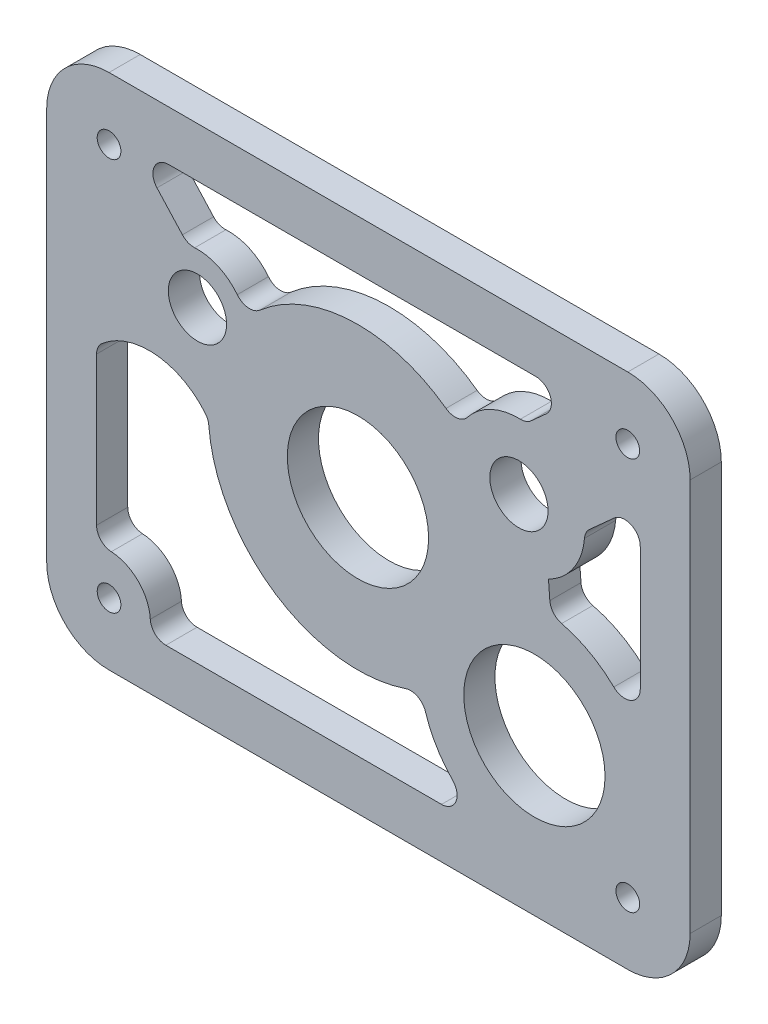
from build123d import *

# Parameters (mm, degrees)
SKETCH1_R           = 14.3891
SKETCH1_R_2         = 5.9309
BOSS_EXTRUDE2_DEPTH = 6.35
SKETCH2_R           = 2.413
CUT_EXTRUDE1_DEPTH  = 6.35
CUT_EXTRUDE6_DEPTH  = 25.4
FILLET4_R           = 3.175
FILLET6_R           = 3.175
FILLET5_R           = 3.175


with BuildPart() as part:
    # Sketch1 → Boss-Extrude2 (new body)
    with BuildSketch(Plane.XY):
        with BuildLine():
            Line((54.963119593, 49.587781591), (-50.700880407, 49.587781591))
            ThreePointArc((-50.700880407, 49.587781591), (-59.681136528, 45.868037712), (-63.400880407, 36.887781591))
            Line((-63.400880407, 36.887781591), (-63.400880407, -43.122218409))
            ThreePointArc((-63.400880407, -43.122218409), (-59.681136528, -52.10247453), (-50.700880407, -55.822218409))
            Line((-50.700880407, -55.822218409), (54.963119593, -55.822218409))
            ThreePointArc((54.963119593, -55.822218409), (63.943375714, -52.10247453), (67.663119593, -43.122218409))
            Line((67.663119593, -43.122218409), (67.663119593, 36.887781591))
            ThreePointArc((67.663119593, 36.887781591), (63.943375714, 45.868037712), (54.963119593, 49.587781591))
        make_face()
        with Locations((35.939214506, -24.072218409)):
            Circle(SKETCH1_R, mode=Mode.SUBTRACT)
        with Locations((-32.69260882, 17.124862832)):
            Circle(SKETCH1_R_2, mode=Mode.SUBTRACT)
        Circle(SKETCH1_R, mode=Mode.SUBTRACT)
        with Locations((32.791546632, 16.934641063)):
            Circle(SKETCH1_R_2, mode=Mode.SUBTRACT)
    extrude(amount=BOSS_EXTRUDE2_DEPTH)

    # Sketch2 → Cut-Extrude1 (cut)
    with BuildSketch(Plane.XY.offset(6.35)):
        with Locations((-50.700880407, 36.887781591)):
            Circle(SKETCH2_R)
        with Locations((54.963119593, 36.887781591)):
            Circle(SKETCH2_R)
        with Locations((54.963119593, -43.122218409)):
            Circle(SKETCH2_R)
        with Locations((-50.700880407, -43.122218409)):
            Circle(SKETCH2_R)
    extrude(amount=-CUT_EXTRUDE1_DEPTH, mode=Mode.SUBTRACT)

    # Sketch3 → Cut-Extrude6 (cut)
    with BuildSketch(Plane.XY.offset(6.35)):
        with BuildLine():
            ThreePointArc((-22.865276921, 20.166764197), (-1.620277869, 30.444933347), (20.595631427, 22.479751622))
            ThreePointArc((20.595631427, 22.479751622), (26.18341036, 28.588873504), (34.294760977, 30.247377274))
            Line((34.294760977, 30.247377274), (44.495862095, 39.427781591))
            Line((44.495862095, 39.427781591), (-45.782707456, 39.427781591))
            Line((-45.782707456, 39.427781591), (-34.660782298, 27.22218472))
            ThreePointArc((-34.660782298, 27.22218472), (-27.411857693, 25.953412186), (-22.865276921, 20.166764197))
        make_face()
        with BuildLine():
            ThreePointArc((27.37738958, -45.662218409), (17.771598796, -38.541865449), (12.980930477, -27.58649508))
            ThreePointArc((12.980930477, -27.58649508), (-15.657094436, -26.160555435), (-30.44625116, -1.595323538))
            ThreePointArc((-30.44625116, -1.595323538), (-41.465480232, 4.60457782), (-53.240880407, 0))
            Line((-53.240880407, 0), (-53.240880407, -35.100222849))
            ThreePointArc((-53.240880407, -35.100222849), (-44.750921888, -37.17225989), (-42.678884848, -45.662218409))
            Line((-42.678884848, -45.662218409), (27.37738958, -45.662218409))
        make_face()
        with BuildLine():
            ThreePointArc((46.188533959, 17.031229414), (44.21986427, 9.94306365), (38.805433181, 4.962934111))
            Line((38.805433181, 4.962934111), (39.269790063, -1.08656609))
            ThreePointArc((39.269790063, -1.08656609), (50.308421041, -5.825058365), (57.503119593, -15.444881422))
            Line((57.503119593, -15.444881422), (57.503119593, 27.213705757))
            Line((57.503119593, 27.213705757), (46.188533959, 17.031229414))
        make_face()
    extrude(amount=-CUT_EXTRUDE6_DEPTH, mode=Mode.SUBTRACT)

    # Fillet4
    fillet4_edges = [part.edges().sort_by_distance(p)[0] for p in [
        (57.503119593, 27.213705757, 3.175),
        (44.495862095, 39.427781591, 3.175),
        (46.188533959, 17.031229414, 3.175),
        (-45.782707456, 39.427781591, 3.175),
        (39.269790063, -1.08656609, 3.175),
        (34.294760977, 30.247377274, 3.175),
        (-34.660782298, 27.22218472, 3.175),
        (-22.865276921, 20.166764197, 3.175),
        (57.503119593, -15.444881422, 3.175),
    ]]
    fillet(fillet4_edges, radius=FILLET4_R)

    # Fillet6
    fillet6_edges = [part.edges().sort_by_distance(p)[0] for p in [
        (20.595631427, 22.479751622, 3.175),
    ]]
    fillet(fillet6_edges, radius=FILLET6_R)

    # Fillet5
    fillet5_edges = [part.edges().sort_by_distance(p)[0] for p in [
        (27.37738958, -45.662218409, 3.175),
        (12.980930477, -27.58649508, 3.175),
        (-30.44625116, -1.595323538, 3.175),
        (-53.240880407, 0, 3.175),
        (-42.678884848, -45.662218409, 3.175),
        (-53.240880407, -35.100222849, 3.175),
    ]]
    fillet(fillet5_edges, radius=FILLET5_R)


solid = part.part
